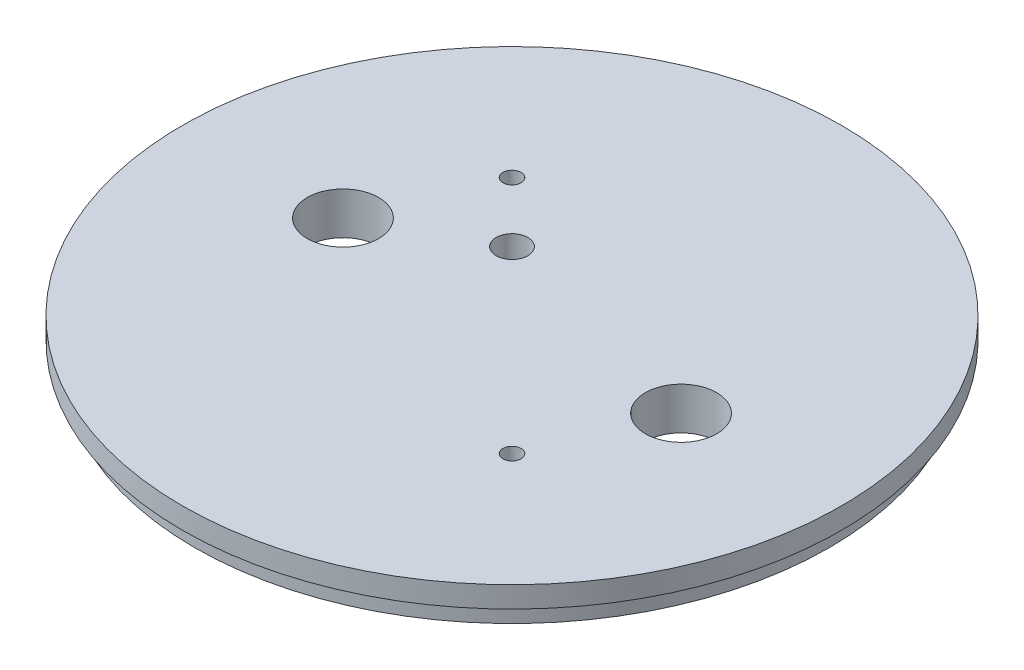
from build123d import *

# Parameters (mm, degrees)
SKETCH1_R           = 49.5173
SKETCH1_R_2         = 5.3578125
SKETCH1_R_3         = 1.3589
SKETCH1_R_4         = 2.38125
BOSS_EXTRUDE1_DEPTH = 6.35
SKETCH2_R           = 49.5173
SKETCH2_R_2         = 47.6885
CUT_EXTRUDE1_DEPTH  = 3.175
CUT_EXTRUDE2_START  = -2.794
CUT_EXTRUDE2_DEPTH  = 3.81


with BuildPart() as part:
    # Sketch1 → Boss-Extrude1 (new body)
    with BuildSketch(Plane(origin=(0, 0, 0), x_dir=(1, 0, 0), z_dir=(0, 1, 0))):
        Circle(SKETCH1_R)
        with Locations((25.4, 0)):
            Circle(SKETCH1_R_2, mode=Mode.SUBTRACT)
        with Locations((-25.4, 0)):
            Circle(SKETCH1_R_2, mode=Mode.SUBTRACT)
        with Locations((-17.960512242, 17.960512242)):
            Circle(SKETCH1_R_3, mode=Mode.SUBTRACT)
        with Locations((17.960512242, -17.960512242)):
            Circle(SKETCH1_R_3, mode=Mode.SUBTRACT)
        with Locations((-8.980256121, 8.980256121)):
            Circle(SKETCH1_R_4, mode=Mode.SUBTRACT)
    extrude(amount=BOSS_EXTRUDE1_DEPTH)

    # Sketch2 → Cut-Extrude1 (cut)
    with BuildSketch(Plane.XZ):
        Circle(SKETCH2_R)
        Circle(SKETCH2_R_2, mode=Mode.SUBTRACT)
    extrude(amount=-CUT_EXTRUDE1_DEPTH, mode=Mode.SUBTRACT)

    # Sketch3 → Cut-Extrude2 (cut)
    with BuildSketch(Plane(origin=(0, 6.35, 0), x_dir=(1, 0, 0), z_dir=(0, 1, 0)).offset(CUT_EXTRUDE2_START)):
        with BuildLine():
            Line((3.2385, 34.925), (3.2385, 13.335))
            ThreePointArc((3.2385, 13.335), (0, 10.0965), (-3.2385, 13.335))
            Line((-3.2385, 13.335), (-3.2385, 34.925))
            ThreePointArc((-3.2385, 34.925), (0, 38.1635), (3.2385, 34.925))
        make_face()
        with BuildLine():
            Line((3.2385, -34.925), (3.2385, -13.335))
            ThreePointArc((3.2385, -13.335), (0, -10.0965), (-3.2385, -13.335))
            Line((-3.2385, -13.335), (-3.2385, -34.925))
            ThreePointArc((-3.2385, -34.925), (0, -38.1635), (3.2385, -34.925))
        make_face()
    extrude(amount=-CUT_EXTRUDE2_DEPTH, mode=Mode.SUBTRACT)


solid = part.part
